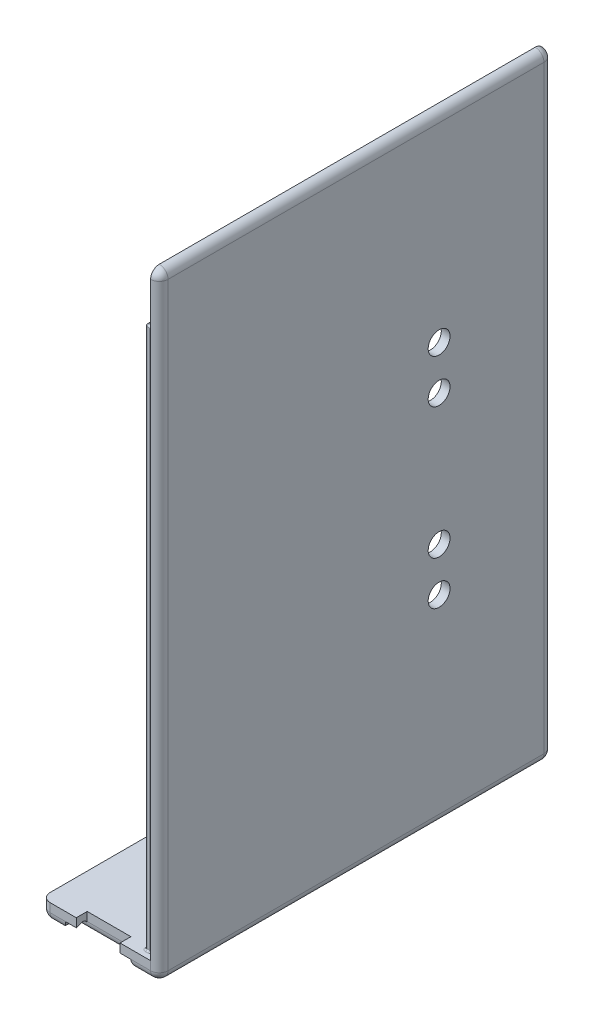
from build123d import *

# Parameters (mm, degrees)
SKETCH1_W           = 25
SKETCH1_H           = 90
BOSS_EXTRUDE1_DEPTH = 4
SKETCH3_W           = 90
SKETCH3_H           = 4
BOSS_EXTRUDE2_DEPTH = 2
SKETCH4_W           = 2
SKETCH4_H           = 90
BOSS_EXTRUDE3_DEPTH = 137
SKETCH6_W           = 10
SKETCH6_H           = 2.5
CUT_EXTRUDE1_DEPTH  = 170.133083694
SKETCH6_3_W         = 10
SKETCH6_3_H         = 2.5
CUT_EXTRUDE2_DEPTH  = 80
SKETCH8_W           = 15
SKETCH8_H           = 2
CUT_EXTRUDE3_DEPTH  = 2.5
CUT_EXTRUDE5_DEPTH  = 15
SKETCH11_W          = 15
SKETCH11_H          = 2
CUT_EXTRUDE6_DEPTH  = 3
CUT_EXTRUDE7_DEPTH  = 15
FILLET6_R           = 2
FILLET7_R           = 2
BOSS_EXTRUDE4_DEPTH = 124
FILLET8_R           = 0.4
FILLET9_R           = 2
SKETCH16_R          = 2.5
CUT_EXTRUDE8_DEPTH  = 10


# Some blends are built 0.0001 mm under size
with BuildPart() as part:
    # Sketch1 → Boss-Extrude1 (new body)
    with BuildSketch(Plane(origin=(0, 0, 0), x_dir=(1, 0, 0), z_dir=(0, 1, 0))):
        with Locations((-12.5, -45)):
            Rectangle(SKETCH1_W, SKETCH1_H)
    extrude(amount=BOSS_EXTRUDE1_DEPTH)

    # Sketch3 → Boss-Extrude2 (add)
    with BuildSketch(Plane(origin=(0, 0, 0), x_dir=(0, 0, -1), z_dir=(1, 0, 0))):
        with Locations((-45, 2)):
            Rectangle(SKETCH3_W, SKETCH3_H)
    extrude(amount=BOSS_EXTRUDE2_DEPTH)

    # Sketch4 → Boss-Extrude3 (add)
    with BuildSketch(Plane(origin=(0, 4, 0), x_dir=(1, 0, 0), z_dir=(0, 1, 0))):
        with Locations((1, -45)):
            Rectangle(SKETCH4_W, SKETCH4_H)
    extrude(amount=BOSS_EXTRUDE3_DEPTH)

    # Sketch6 → Cut-Extrude1 (cut, through all)
    with BuildSketch(Plane.XZ):
        with Locations((-12, 1.25)):
            Rectangle(SKETCH6_W, SKETCH6_H)
    extrude(amount=-CUT_EXTRUDE1_DEPTH, mode=Mode.SUBTRACT)

    # Sketch6<3> → Cut-Extrude2 (cut)
    with BuildSketch(Plane.XZ):
        with Locations((-12, 88.75)):
            Rectangle(SKETCH6_3_W, SKETCH6_3_H)
    extrude(amount=-CUT_EXTRUDE2_DEPTH, mode=Mode.SUBTRACT)

    # Sketch8 → Cut-Extrude3 (cut)
    with BuildSketch(Plane.XY.offset(90)):
        with Locations((-12, 1)):
            Rectangle(SKETCH8_W, SKETCH8_H)
    extrude(amount=-CUT_EXTRUDE3_DEPTH, mode=Mode.SUBTRACT)

    # Sketch9 → Cut-Extrude5 (cut)
    with BuildSketch(Plane.ZY.offset(4.5)):
        with BuildLine():
            ThreePointArc((88.5, 2.5), (88, 2.366025404), (87.633974596, 2))
            Line((87.633974596, 2), (90, 2))
            Line((90, 2), (88.5, 2.5))
        make_face()
    extrude(amount=CUT_EXTRUDE5_DEPTH, mode=Mode.SUBTRACT)

    # Sketch11 → Cut-Extrude6 (cut)
    with BuildSketch(Plane(origin=(0, 0, 0), x_dir=(-1, 0, 0), z_dir=(0, 0, -1))):
        with Locations((12, 1)):
            Rectangle(SKETCH11_W, SKETCH11_H)
    extrude(amount=-CUT_EXTRUDE6_DEPTH, mode=Mode.SUBTRACT)

    # Sketch12 → Cut-Extrude7 (cut)
    with BuildSketch(Plane.ZY.offset(4.5)):
        with BuildLine():
            ThreePointArc((2.766025404, 2), (2.4, 2.366025404), (1.9, 2.5))
            Line((1.9, 2.5), (0, 2))
            Line((0, 2), (2.766025404, 2))
        make_face()
    extrude(amount=CUT_EXTRUDE7_DEPTH, mode=Mode.SUBTRACT)

    # Fillet6
    fillet6_edges = [part.edges().sort_by_distance(p)[0] for p in [
        (-22.25, 0, 0),
        (-12, 0, 3),
        (-19.5, 0, 1.5),
        (-4.5, 0, 1.5),
        (2, 0, 45),
        (-22.25, 0, 90),
        (-25, 0, 45),
        (-1.25, 0, 0),
        (-12, 0, 87.5),
        (-1.25, 0, 90),
        (-4.5, 0, 88.75),
        (-19.5, 0, 88.75),
    ]]
    fillet(fillet6_edges, radius=FILLET6_R - 0.0001)  # a hair under: the kernel refuses the full size

    # Fillet7
    # the kernel refuses this fillet: 2 mm, written as the material it takes off along each edge
    with BuildSketch(Plane(origin=(-23, 0, 88), x_dir=(0, 0, 1), z_dir=(1, 0, 0))) as fillet7_piece_1:
        with BuildLine():
            CenterArc((0.0001, -1.9999), 1.9999, 0, 90)
            Line((2, -1.9999), (2, 0))
            Line((2, 0), (0.0001, 0))
        make_face()
    revolve(axis=Axis((-23, 0, 88), (0, -1, 0)), revolution_arc=90, mode=Mode.SUBTRACT)
    with BuildSketch(Plane(origin=(-23, 0, 2), x_dir=(-1, 0, 0), z_dir=(0, 0, 1))) as fillet7_piece_2:
        with BuildLine():
            CenterArc((0.0001, -1.9999), 1.9999, 0, 90)
            Line((2, -1.9999), (2, 0))
            Line((2, 0), (0.0001, 0))
        make_face()
    revolve(axis=Axis((-23, 0, 2), (0, -1, 0)), revolution_arc=90, mode=Mode.SUBTRACT)
    with BuildSketch(Plane(origin=(-25, 0, 90), x_dir=(0, 0, -1), z_dir=(0, 1, 0)), Plane(origin=(-25, 0, 0), x_dir=(1, 0, 0), z_dir=(0, 1, 0))) as fillet7_piece_3:
        with BuildLine():
            CenterArc((FILLET7_R, -FILLET7_R), FILLET7_R, 90, 90)
            Line((0, -FILLET7_R), (0, 0))
            Line((0, 0), (FILLET7_R, 0))
        make_face()
    extrude(amount=9, mode=Mode.SUBTRACT)

    # Sketch13 → Boss-Extrude4 (add)
    with BuildSketch(Plane(origin=(0, 4, 0), x_dir=(1, 0, 0), z_dir=(0, 1, 0))):
        Polygon((0, -4.05), (-1.4, -4.05), (-1.4, -1.6), (-2.8, -1.6), (-2.8, -5.4), (0, -5.4), align=None)
        Polygon((-1.4, -88.4), (-2.8, -88.4), (-2.8, -84.6), (0, -84.6), (0, -85.95), (-1.4, -85.95), align=None)
    extrude(amount=BOSS_EXTRUDE4_DEPTH)

    # Fillet8
    fillet8_edges = [part.edges().sort_by_distance(p)[0] for p in [
        (0, 66, 5.4),
        (-1.4, 4, 2.825),
        (-2.1, 4, 1.6),
        (-1.4, 66, 1.6),
        (-2.8, 4, 3.5),
        (-2.8, 66, 1.6),
        (-1.4, 4, 5.4),
        (-2.8, 66, 5.4),
        (0, 128, 4.725),
        (-2.1, 128, 1.6),
        (-2.8, 128, 3.5),
        (-1.4, 128, 5.4),
        (-1.4, 4, 87.175),
        (-1.4, 66, 88.4),
        (-1.4, 4, 84.6),
        (0, 66, 84.6),
        (-2.8, 4, 86.5),
        (-2.8, 66, 84.6),
        (-2.1, 4, 88.4),
        (-2.8, 66, 88.4),
        (0, 128, 85.275),
        (-1.4, 128, 84.6),
        (-2.8, 128, 86.5),
        (-2.1, 128, 88.4),
    ]]
    fillet(fillet8_edges, radius=FILLET8_R)

    # Fillet9
    # the kernel refuses this fillet: 2 mm, written as the material it takes off along each edge
    with BuildSketch(Plane(origin=(0, 0, 88), x_dir=(1, 0, 0), z_dir=(0, 0, -1))) as fillet9_piece_1:
        with BuildLine():
            CenterArc((0.0001, -1.9999), 1.9999, 0, 90)
            Line((2, -1.9999), (2, 0))
            Line((2, 0), (0.0001, 0))
        make_face()
    revolve(axis=Axis((0, 0, 88), (0, -1, 0)), revolution_arc=90, mode=Mode.SUBTRACT)
    with BuildSketch(Plane(origin=(0, 0, 2), x_dir=(0, 0, -1), z_dir=(-1, 0, 0))) as fillet9_piece_2:
        with BuildLine():
            CenterArc((0.0001, -1.9999), 1.9999, 0, 90)
            Line((2, -1.9999), (2, 0))
            Line((2, 0), (0.0001, 0))
        make_face()
    revolve(axis=Axis((0, 0, 2), (0, -1, 0)), revolution_arc=90, mode=Mode.SUBTRACT)
    with BuildSketch(Plane(origin=(0, 139, 88), x_dir=(0, 0, 1), z_dir=(1, 0, 0))) as fillet9_piece_3_section:
        Polygon((0, 0), (FILLET9_R, 0), (FILLET9_R, -FILLET9_R), (0, -FILLET9_R), align=None)
    fillet9_piece_3 = extrude(amount=FILLET9_R, mode=Mode.PRIVATE)
    fillet9_piece_3 = fillet9_piece_3 - Plane(origin=(0, 139, 88), x_dir=(0, -0.7071067811865475, -0.7071067811865475), z_dir=(1, 0, 0)) * Sphere(FILLET9_R, mode=Mode.PRIVATE)
    add(fillet9_piece_3, mode=Mode.SUBTRACT)
    with BuildSketch(Plane(origin=(0, 139, 2), x_dir=(0, 0, -1), z_dir=(0, 1, 0))) as fillet9_piece_4_section:
        Polygon((0, 0), (FILLET9_R, 0), (FILLET9_R, -FILLET9_R), (0, -FILLET9_R), align=None)
    fillet9_piece_4 = extrude(amount=FILLET9_R, mode=Mode.PRIVATE)
    fillet9_piece_4 = fillet9_piece_4 - Plane(origin=(0, 139, 2), x_dir=(-0.7071067811865474, 0, 0.7071067811865476), z_dir=(0, 1, 0)) * Sphere(FILLET9_R, mode=Mode.PRIVATE)
    add(fillet9_piece_4, mode=Mode.SUBTRACT)
    with BuildSketch(Plane(origin=(2, 139, 90), x_dir=(-1, 0, 0), z_dir=(0, -1, 0)), Plane(origin=(2, 139, 0), x_dir=(0, 0, 1), z_dir=(0, -1, 0))) as fillet9_piece_5:
        with BuildLine():
            CenterArc((FILLET9_R, FILLET9_R), FILLET9_R, 180, 90)
            Line((0, FILLET9_R), (0, 0))
            Line((0, 0), (FILLET9_R, 0))
        make_face()
    extrude(amount=139, mode=Mode.SUBTRACT)
    with BuildSketch(Plane(origin=(2, 141, 2), x_dir=(-1, 0, 0), z_dir=(0, 0, 1))) as fillet9_piece_6:
        with BuildLine():
            CenterArc((FILLET9_R, FILLET9_R), FILLET9_R, 180, 90)
            Line((0, FILLET9_R), (0, 0))
            Line((0, 0), (FILLET9_R, 0))
        make_face()
    extrude(amount=86, mode=Mode.SUBTRACT)
    with BuildSketch(Plane(origin=(-5, 141, 0), x_dir=(0, 0, 1), z_dir=(1, 0, 0))) as fillet9_piece_7:
        with BuildLine():
            CenterArc((FILLET9_R, FILLET9_R), FILLET9_R, 180, 90)
            Line((0, FILLET9_R), (0, 0))
            Line((0, 0), (FILLET9_R, 0))
        make_face()
    extrude(amount=5, mode=Mode.SUBTRACT)
    with BuildSketch(Plane(origin=(0, 141, 90), x_dir=(0, -1, 0), z_dir=(-1, 0, 0))) as fillet9_piece_8:
        with BuildLine():
            CenterArc((FILLET9_R, -FILLET9_R), FILLET9_R, 90, 90)
            Line((0, -FILLET9_R), (0, 0))
            Line((0, 0), (FILLET9_R, 0))
        make_face()
    extrude(amount=5, mode=Mode.SUBTRACT)

    # Sketch16 → Cut-Extrude8 (cut)
    with BuildSketch(Plane(origin=(2, 0, 0), x_dir=(0, 0, -1), z_dir=(1, 0, 0))):
        with Locations((-25.986220839, 95.5)):
            Circle(SKETCH16_R)
        with Locations((-25.986220839, 85.5)):
            Circle(SKETCH16_R)
        with Locations((-25.986220839, 55.5)):
            Circle(SKETCH16_R)
        with Locations((-25.986220839, 45.5)):
            Circle(SKETCH16_R)
    extrude(amount=-CUT_EXTRUDE8_DEPTH, mode=Mode.SUBTRACT)


solid = part.part
